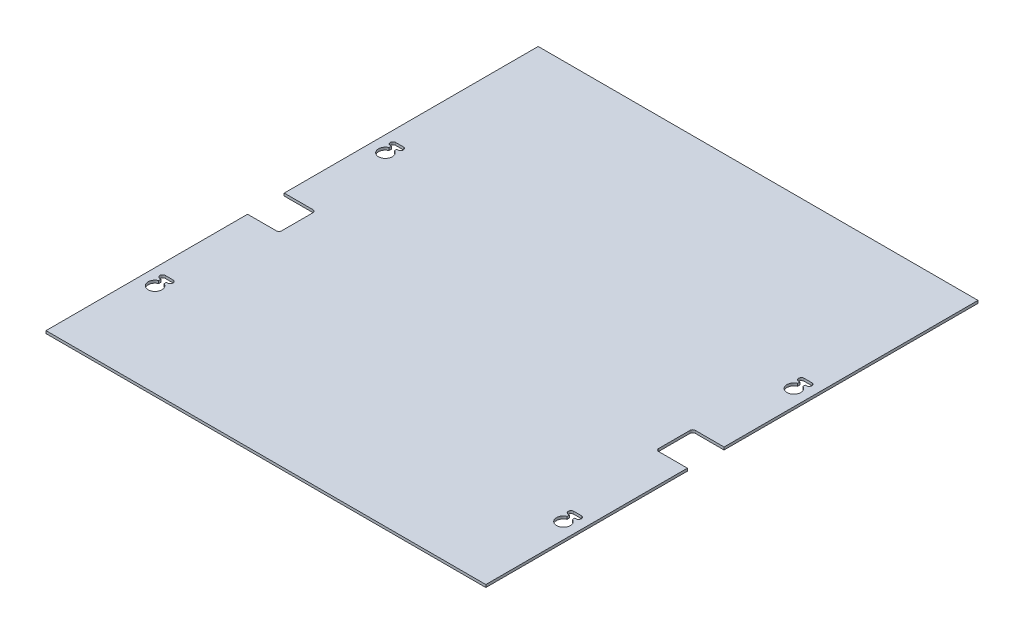
from build123d import *

# Parameters (mm, degrees)
SKETCH1_W                    = 533.4
SKETCH1_H                    = 596.9
BOSS_EXTRUDE1_DEPTH          = 3.175
CUT_EXTRUDE1_DEPTH           = 401.264129201
F_0_257_DIAMETER_SLOT1_DEPTH = 3.175
SKETCH8_W                    = 38.1
SKETCH8_H                    = 44.45
CUT_EXTRUDE2_DEPTH           = 401.264129201
FILLET1_R                    = 3.175


# Read off the part's stored shape, not the designer's step: F (0.257) Diameter Slot1
with BuildPart() as part:
    # Sketch1 → Boss-Extrude1 (new body)
    with BuildSketch(Plane(origin=(0, 0, 0), x_dir=(1, 0, 0), z_dir=(0, 1, 0))):
        Rectangle(SKETCH1_W, SKETCH1_H)
    extrude(amount=BOSS_EXTRUDE1_DEPTH)

    # Sketch5 → Cut-Extrude1 (cut, through all)
    with BuildSketch(Plane.XZ):
        with BuildLine():
            Line((244.385805934, -101.878160113), (244.385805934, -107.950617892))
            ThreePointArc((244.385805934, -107.950617892), (247.65, -111.213899987), (250.913605875, -107.950029643))
            Line((250.913605875, -107.950029643), (250.913605875, -101.878279337))
            ThreePointArc((250.913605875, -101.878279337), (247.65, -85.775799987), (244.385805934, -101.878160113))
        make_face()
        with BuildLine():
            Line((250.9139, 177.521780271), (250.9139, 171.450000343))
            ThreePointArc((250.9139, 171.450000343), (247.65, 168.1861), (244.3861, 171.450000343))
            Line((244.3861, 171.450000343), (244.3861, 177.521780271))
            ThreePointArc((244.3861, 177.521780271), (247.65, 193.6242), (250.9139, 177.521780271))
        make_face()
        with BuildLine():
            Line((-244.3861, 177.521780271), (-244.3861, 171.450000343))
            ThreePointArc((-244.3861, 171.450000343), (-247.65, 168.1861), (-250.9139, 171.450000343))
            Line((-250.9139, 171.450000343), (-250.9139, 177.521780271))
            ThreePointArc((-250.9139, 177.521780271), (-247.65, 193.6242), (-244.3861, 177.521780271))
        make_face()
        with BuildLine():
            Line((-250.913605875, -101.878279337), (-250.913605875, -107.950029643))
            ThreePointArc((-250.913605875, -107.950029643), (-247.65, -111.213899987), (-244.385805934, -107.950617892))
            Line((-244.385805934, -107.950617892), (-244.385805934, -101.878160113))
            ThreePointArc((-244.385805934, -101.878160113), (-247.65, -85.775799987), (-250.913605875, -101.878279337))
        make_face()
    extrude(amount=-CUT_EXTRUDE1_DEPTH, mode=Mode.SUBTRACT)

    # F (0.257) Diameter Slot1 outline → F (0.257) Diameter Slot1 (cut)
    with BuildSketch(Plane(origin=(0, 0, 0), x_dir=(1, 0, 0), z_dir=(0, 1, 0))):
        with BuildLine():
            ThreePointArc((252.3236, -174.7139), (255.5875, -171.45), (252.3236, -168.1861))
            Line((252.3236, -168.1861), (247.65, -168.1861))
            ThreePointArc((247.65, -168.1861), (249.957925944, -169.142074298), (250.9139, -171.450000343))
            Line((250.9139, -171.450000343), (250.9139, -174.7139))
            Line((250.9139, -174.7139), (252.3236, -174.7139))
        make_face()
        with BuildLine():
            ThreePointArc((244.3861, -171.450000343), (245.342074056, -169.142074298), (247.65, -168.1861))
            Line((247.65, -168.1861), (242.9764, -168.1861))
            ThreePointArc((242.9764, -168.1861), (239.7125, -171.45), (242.9764, -174.7139))
            Line((242.9764, -174.7139), (244.3861, -174.7139))
            Line((244.3861, -174.7139), (244.3861, -171.450000343))
        make_face()
        with BuildLine():
            ThreePointArc((-242.9764, -174.7139), (-239.7125, -171.45), (-242.9764, -168.1861))
            Line((-242.9764, -168.1861), (-247.65, -168.1861))
            ThreePointArc((-247.65, -168.1861), (-245.342074056, -169.142074298), (-244.3861, -171.450000343))
            Line((-244.3861, -171.450000343), (-244.3861, -174.7139))
            Line((-244.3861, -174.7139), (-242.9764, -174.7139))
        make_face()
        with BuildLine():
            ThreePointArc((-250.9139, -171.450000343), (-249.957925944, -169.142074298), (-247.65, -168.1861))
            Line((-247.65, -168.1861), (-252.3236, -168.1861))
            ThreePointArc((-252.3236, -168.1861), (-255.5875, -171.45), (-252.3236, -174.7139))
            Line((-252.3236, -174.7139), (-250.9139, -174.7139))
            Line((-250.9139, -174.7139), (-250.9139, -171.450000343))
        make_face()
        with BuildLine():
            ThreePointArc((252.323305875, 104.6861), (255.587205875, 107.95), (252.323305875, 111.2139))
            Line((252.323305875, 111.2139), (247.649705875, 111.2139))
            ThreePointArc((247.649705875, 111.2139), (249.957621218, 110.257936304), (250.913605875, 107.950029643))
            Line((250.913605875, 107.950029643), (250.913605875, 104.6861))
            Line((250.913605875, 104.6861), (252.323305875, 104.6861))
        make_face()
        with BuildLine():
            ThreePointArc((244.385805934, 107.950617892), (245.34199852, 110.258144271), (247.649705875, 111.2139))
            Line((247.649705875, 111.2139), (242.976105875, 111.2139))
            ThreePointArc((242.976105875, 111.2139), (239.712205875, 107.95), (242.976105875, 104.6861))
            Line((242.976105875, 104.6861), (244.385805934, 104.6861))
            Line((244.385805934, 104.6861), (244.385805934, 107.950617892))
        make_face()
        with BuildLine():
            ThreePointArc((-242.976105875, 104.6861), (-239.712205875, 107.95), (-242.976105875, 111.2139))
            Line((-242.976105875, 111.2139), (-247.649705876, 111.2139))
            ThreePointArc((-247.649705876, 111.2139), (-245.341998521, 110.258144271), (-244.385805934, 107.950617892))
            Line((-244.385805934, 107.950617892), (-244.385805934, 104.6861))
            Line((-244.385805934, 104.6861), (-242.976105875, 104.6861))
        make_face()
        with BuildLine():
            ThreePointArc((-250.913605875, 107.950029643), (-249.957621218, 110.257936303), (-247.649705876, 111.2139))
            Line((-247.649705876, 111.2139), (-252.323305875, 111.2139))
            ThreePointArc((-252.323305875, 111.2139), (-255.587205875, 107.95), (-252.323305875, 104.6861))
            Line((-252.323305875, 104.6861), (-250.913605875, 104.6861))
            Line((-250.913605875, 104.6861), (-250.913605875, 107.950029643))
        make_face()
    extrude(amount=F_0_257_DIAMETER_SLOT1_DEPTH, mode=Mode.SUBTRACT)

    # Sketch8 → Cut-Extrude2 (cut, through all)
    with BuildSketch(Plane.XZ):
        with Locations((-247.65, 31.75)):
            Rectangle(SKETCH8_W, SKETCH8_H)
        with Locations((247.65, 31.75)):
            Rectangle(SKETCH8_W, SKETCH8_H)
    extrude(amount=-CUT_EXTRUDE2_DEPTH, mode=Mode.SUBTRACT)

    # Fillet1
    fillet1_edges = [part.edges().sort_by_distance(p)[0] for p in [
        (-228.6, 1.5875, 53.975),
        (-228.6, 1.5875, 9.525),
        (228.6, 1.5875, 9.525),
        (228.6, 1.5875, 53.975),
    ]]
    fillet(fillet1_edges, radius=FILLET1_R)


solid = part.part
